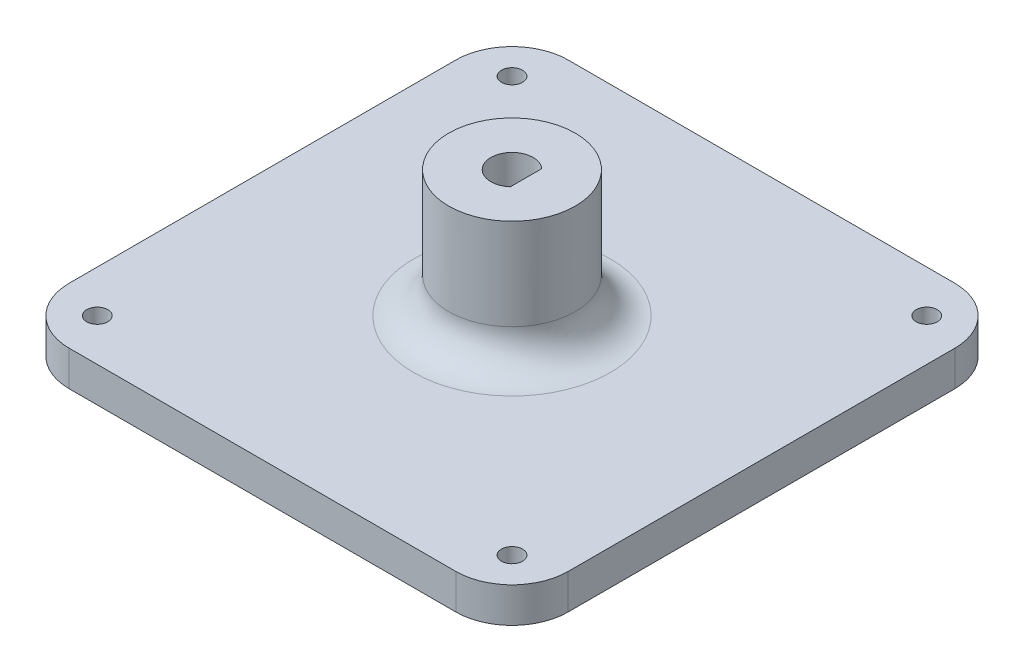
from build123d import *

# Parameters (mm, degrees)
SKETCH1_W           = 71
SKETCH1_H           = 71
BOSS_EXTRUDE1_DEPTH = 5
SKETCH2_R           = 9
BOSS_EXTRUDE2_DEPTH = 18
FILLET1_R           = 5
CUT_EXTRUDE1_DEPTH  = 16
FILLET2_R           = 8
SKETCH4_R           = 1.5
CUT_EXTRUDE2_DEPTH  = 103.00980345
CUT_EXTRUDE3_DEPTH  = 10


with BuildPart() as part:
    # Sketch1 → Boss-Extrude1 (new body)
    with BuildSketch(Plane(origin=(0, 0, 0), x_dir=(1, 0, 0), z_dir=(0, 1, 0))):
        with Locations((35.5, 35.5)):
            Rectangle(SKETCH1_W, SKETCH1_H)
    extrude(amount=BOSS_EXTRUDE1_DEPTH)

    # Sketch2 → Boss-Extrude2 (add)
    with BuildSketch(Plane(origin=(0, 5, 0), x_dir=(1, 0, 0), z_dir=(0, 1, 0))):
        with Locations((35.5, 35.5)):
            Circle(SKETCH2_R)
    extrude(amount=BOSS_EXTRUDE2_DEPTH)

    # Fillet1
    fillet1_edges = [part.edges().sort_by_distance(p)[0] for p in [
        (26.5, 5, -35.5),
    ]]
    fillet(fillet1_edges, radius=FILLET1_R)

    # Sketch3 → Cut-Extrude1 (cut)
    with BuildSketch(Plane(origin=(0, 23, 0), x_dir=(1, 0, 0), z_dir=(0, 1, 0))):
        with BuildLine():
            Line((37.5, 33.263932023), (37.5, 37.736067977))
            ThreePointArc((37.5, 37.736067977), (32.5, 35.5), (37.5, 33.263932023))
        make_face()
    extrude(amount=-CUT_EXTRUDE1_DEPTH, mode=Mode.SUBTRACT)

    # Fillet2
    fillet2_edges = [part.edges().sort_by_distance(p)[0] for p in [
        (0, 2.5, 0),
        (71, 2.5, 0),
        (71, 2.5, -71),
        (0, 2.5, -71),
    ]]
    fillet(fillet2_edges, radius=FILLET2_R)

    # Sketch4 → Cut-Extrude2 (cut, through all)
    with BuildSketch(Plane(origin=(0, 5, 0), x_dir=(1, 0, 0), z_dir=(0, 1, 0))):
        with Locations((65, 65)):
            Circle(SKETCH4_R)
        with Locations((65, 6)):
            Circle(SKETCH4_R)
        with Locations((6, 6)):
            Circle(SKETCH4_R)
        with Locations((6, 65)):
            Circle(SKETCH4_R)
    extrude(amount=-CUT_EXTRUDE2_DEPTH, mode=Mode.SUBTRACT)

    # Sketch5 → Cut-Extrude3 (cut)
    with BuildSketch(Plane(origin=(0, 0, 0), x_dir=(-1, 0, 0), z_dir=(0, -1, 0))):
        Polygon((-43.582903769, 35.5), (-39.541451884, 28.5), (-31.458548116, 28.5), (-27.417096231, 35.5), (-31.458548116, 42.5), (-39.541451884, 42.5), align=None)
    extrude(amount=-CUT_EXTRUDE3_DEPTH, mode=Mode.SUBTRACT)


solid = part.part
